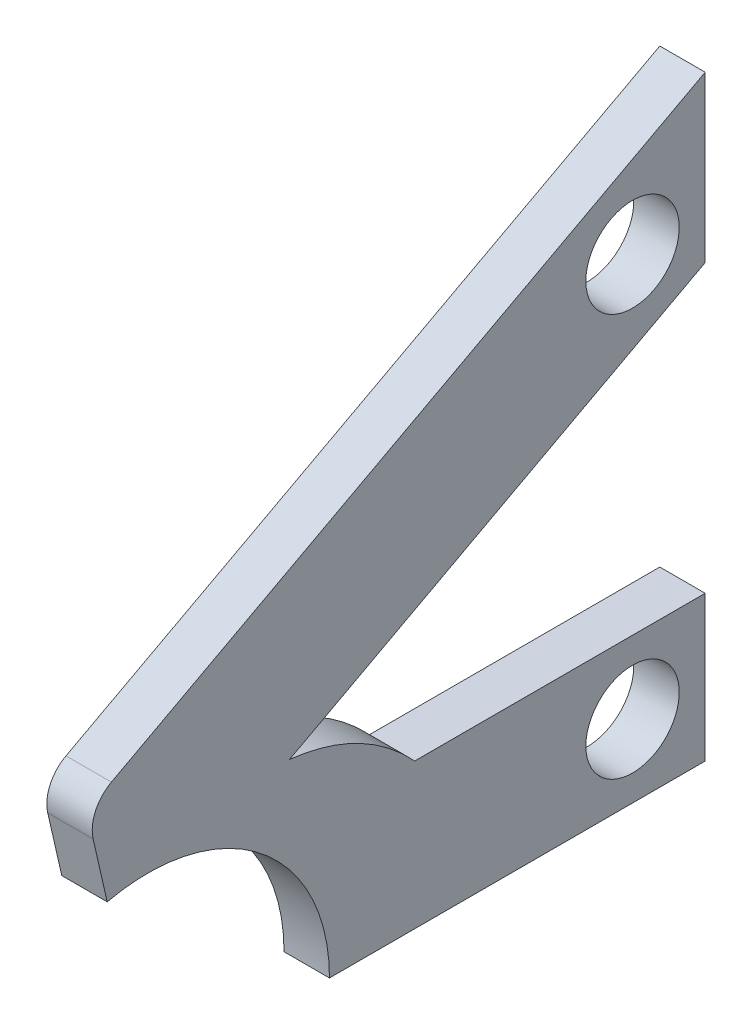
from build123d import *

# Parameters (mm, degrees)
SKETCH2_R           = 3.2639
BOSS_EXTRUDE1_DEPTH = 3.175


with BuildPart() as part:
    # Sketch2 → Boss-Extrude1 (new body)
    with BuildSketch(Plane(origin=(-112.555, 0, -573.58969557), x_dir=(0, 0.6231241879767124, 0.7821229100073485), z_dir=(-1, 0, 0))):
        with BuildLine():
            Line((843.785187932, 138.582376841), (864.330586832, 122.213677187))
            ThreePointArc((864.330586832, 122.213677187), (874.263547789, 127), (884.196508746, 122.213677187))
            Line((884.196508746, 122.213677187), (887.645495372, 124.961515108))
            ThreePointArc((887.645495372, 124.961515108), (888.526447304, 126.330171585), (888.395706135, 127.952578317))
            Line((888.395706135, 127.952578317), (869.77401473, 171.202610873))
            Line((869.77401473, 171.202610873), (862.593047153, 162.189320479))
            Line((862.593047153, 162.189320479), (875.624929298, 131.921966414))
            add(Edge.make_bspline(
                [(866.008867214, 133.866862107), (871.18323177, 134.685144315), (875.624929298, 131.921966414)],
                knots=[0, 0, 0, 1, 1, 1], degree=2))
            Line((866.008867214, 133.866862107), (850.116129682, 146.528745607))
            Line((850.116129682, 146.528745607), (843.785187932, 138.582376841))
        make_face()
        with Locations((850.92384319, 139.390090349)):
            Circle(SKETCH2_R, mode=Mode.SUBTRACT)
        with Locations((868.462204193, 161.403605807)):
            Circle(SKETCH2_R, mode=Mode.SUBTRACT)
    extrude(amount=BOSS_EXTRUDE1_DEPTH)


solid = part.part
